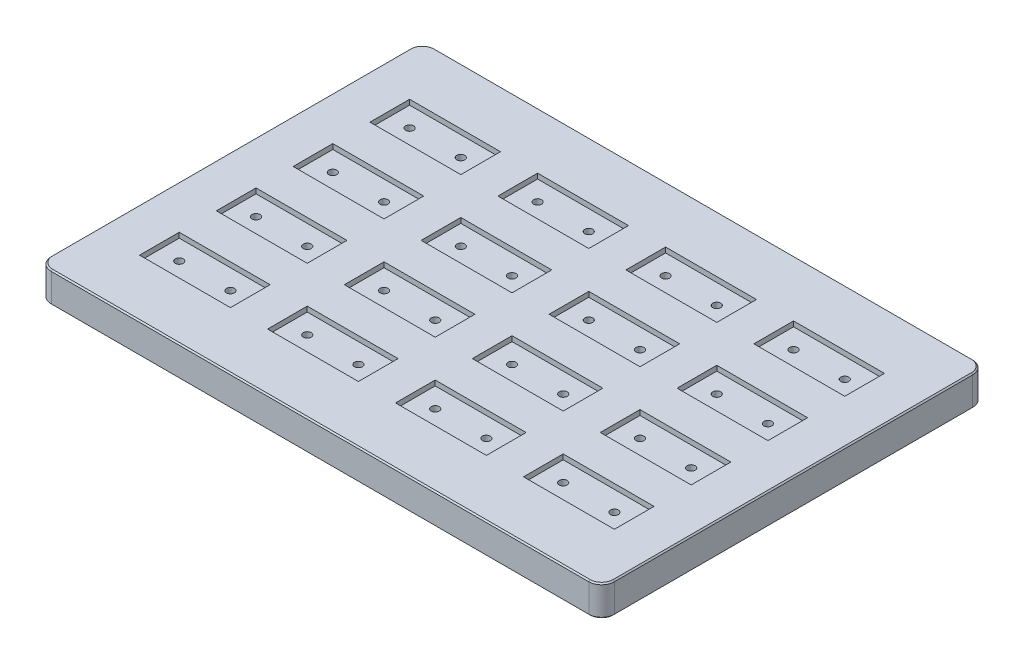
from build123d import *

# Parameters (mm, degrees)
SKETCH1_W            = 220
SKETCH1_H            = 150
BOSS_EXTRUDE1_DEPTH  = 12
SKETCH2_W            = 35.5
SKETCH2_H            = 15.5
CUT_EXTRUDE1_DEPTH   = 2
LPATTERN1_COUNT      = 4
LPATTERN1_PITCH      = 30
LPATTERN1_COUNT_DIR2 = 4
LPATTERN1_PITCH_DIR2 = 50
SKETCH3_R            = 1.55
CUT_EXTRUDE2_DEPTH   = 267.458251889
LPATTERN2_COUNT      = 4
LPATTERN2_PITCH      = 30
LPATTERN2_COUNT_DIR2 = 4
LPATTERN2_PITCH_DIR2 = 50
SKETCH4_W            = 200
SKETCH4_H            = 130
CUT_EXTRUDE3_DEPTH   = 3
FILLET1_R            = 5
CHAMFER1_SIZE        = 0.5


with BuildPart() as part:
    # Sketch1 → Boss-Extrude1 (new body)
    with BuildSketch(Plane(origin=(0, 0, 0), x_dir=(1, 0, 0), z_dir=(0, 1, 0))):
        with Locations((110, 75)):
            Rectangle(SKETCH1_W, SKETCH1_H)
    extrude(amount=BOSS_EXTRUDE1_DEPTH)

    # Sketch2 → Cut-Extrude1 (cut)
    with BuildSketch(Plane(origin=(0, 12, 0), x_dir=(1, 0, 0), z_dir=(0, 1, 0))):
        with Locations((35, 30)):
            Rectangle(SKETCH2_W, SKETCH2_H)
    cut_extrude1 = extrude(amount=-CUT_EXTRUDE1_DEPTH, mode=Mode.SUBTRACT)

    # LPattern1: Cut-Extrude1 4 × 4
    with Locations(*[(j * LPATTERN1_PITCH_DIR2, 0, -i * LPATTERN1_PITCH) for i in range(LPATTERN1_COUNT) for j in range(LPATTERN1_COUNT_DIR2) if (i, j) != (0, 0)]):
        add(cut_extrude1, mode=Mode.SUBTRACT)

    # Sketch3 → Cut-Extrude2 (cut, through all)
    with BuildSketch(Plane(origin=(0, 10, 0), x_dir=(1, 0, 0), z_dir=(0, 1, 0))):
        with Locations((25, 30)):
            Circle(SKETCH3_R)
        with Locations((45, 30)):
            Circle(SKETCH3_R)
    cut_extrude2 = extrude(amount=-CUT_EXTRUDE2_DEPTH, mode=Mode.SUBTRACT)

    # LPattern2: Cut-Extrude2 4 × 4
    with Locations(*[(j * LPATTERN2_PITCH_DIR2, 0, -i * LPATTERN2_PITCH) for i in range(LPATTERN2_COUNT) for j in range(LPATTERN2_COUNT_DIR2) if (i, j) != (0, 0)]):
        add(cut_extrude2, mode=Mode.SUBTRACT)

    # Sketch4 → Cut-Extrude3 (cut)
    with BuildSketch(Plane.XZ):
        with Locations((110, -75)):
            Rectangle(SKETCH4_W, SKETCH4_H)
    extrude(amount=-CUT_EXTRUDE3_DEPTH, mode=Mode.SUBTRACT)

    # Fillet1
    fillet1_edges = [part.edges().sort_by_distance(p)[0] for p in [
        (0, 6, -150),
        (0, 6, 0),
        (220, 6, 0),
        (220, 6, -150),
    ]]
    fillet(fillet1_edges, radius=FILLET1_R)

    # Chamfer1
    chamfer1_edges = [part.edges().sort_by_distance(p)[0] for p in [
        (0, 0, -75),
        (1.464466094, 0, -1.464466094),
        (1.464466094, 0, -148.535533906),
        (110, 0, -150),
        (218.535533906, 0, -1.464466094),
        (218.535533906, 0, -148.535533906),
        (220, 0, -75),
        (0, 12, -75),
        (1.464466094, 12, -1.464466094),
        (1.464466094, 12, -148.535533906),
        (110, 12, 0),
        (110, 12, -150),
        (218.535533906, 12, -1.464466094),
        (218.535533906, 12, -148.535533906),
        (220, 12, -75),
        (110, 0, 0),
    ]]
    chamfer(chamfer1_edges, length=CHAMFER1_SIZE)


solid = part.part
